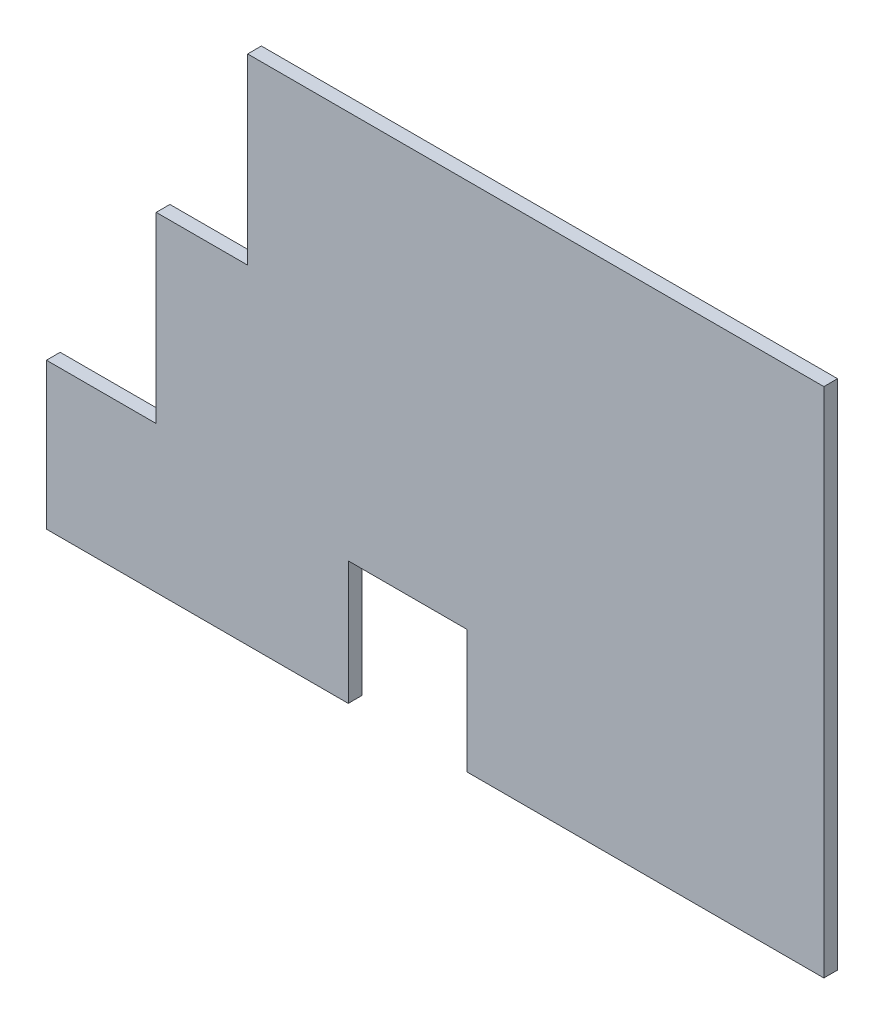
from build123d import *

# Parameters (mm, degrees)
DODANIE_WYCI_GNI_CIE1_DEPTH = 1.5


with BuildPart() as part:
    # Szkic1 → Dodanie-wyciągnięcie1 (new body)
    with BuildSketch(Plane.XY):
        Polygon((9.013627716, -46.099619819), (48.013627716, -46.099619819), (48.013627716, 9.900380181), (-14.986372284, 9.900380181), (-14.986372284, -10.099619819), (-24.986372284, -10.099619819), (-24.986372284, -30.099619819), (-36.986372284, -30.099619819), (-36.986372284, -46.099619819), (-3.986372284, -46.099619819), (-3.986372284, -32.599619819), (9.013627716, -32.599619819), align=None)
    extrude(amount=DODANIE_WYCI_GNI_CIE1_DEPTH)


solid = part.part
